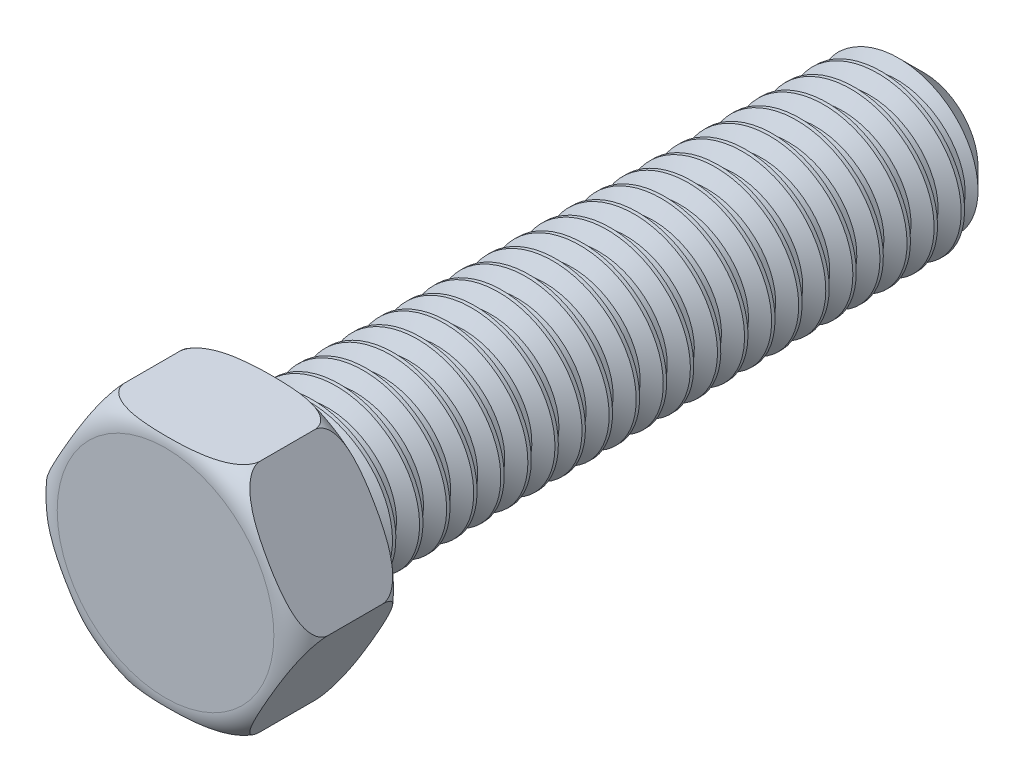
from build123d import *

# Parameters (mm, degrees)
SKETCH2_R           = 2.5
BOSS_EXTRUDE1_DEPTH = 2
FILLET1_R           = 0.5
SKETCH3_OUTSIDE_W   = 8.47
SKETCH3_OUTSIDE_H   = 8.47
CUT_EXTRUDE1_DEPTH  = 5.062019202
SKETCH4_R           = 1.5
BOSS_EXTRUDE2_DEPTH = 12
CHAMFER1_SIZE       = 0.5
THREAD1_PITCH       = 0.5


with BuildPart() as part:
    # Sketch2 → Boss-Extrude1 (new body)
    with BuildSketch(Plane.XY):
        Circle(SKETCH2_R)
    extrude(amount=BOSS_EXTRUDE1_DEPTH)

    # Fillet1
    fillet1_edges = [part.edges().sort_by_distance(p)[0] for p in [
        (-2.5, 0, 0),
        (-2.5, 0, 2),
    ]]
    fillet(fillet1_edges, radius=FILLET1_R)

    # Sketch3 outside → Cut-Extrude1 (cut, through all)
    with BuildSketch(Plane.XY.offset(2)):
        Rectangle(SKETCH3_OUTSIDE_W, SKETCH3_OUTSIDE_H)
        Polygon((2.5, 0), (1.25, 2.165063509), (-1.25, 2.165063509), (-2.5, 0), (-1.25, -2.165063509), (1.25, -2.165063509), align=None, mode=Mode.SUBTRACT)
    extrude(amount=-CUT_EXTRUDE1_DEPTH, mode=Mode.SUBTRACT)


with BuildPart() as body_2:
    # Sketch4 → Boss-Extrude2 (new body)
    with BuildSketch(Plane(origin=(0, 0, 0), x_dir=(-1, 0, 0), z_dir=(0, 0, -1))):
        Circle(SKETCH4_R)
    extrude(amount=BOSS_EXTRUDE2_DEPTH)

    # Chamfer1
    chamfer1_edges = [body_2.edges().sort_by_distance(p)[0] for p in [
        (1.5, 0, -12),
    ]]
    chamfer(chamfer1_edges, length=CHAMFER1_SIZE)

    # Thread1: the profile of Thread Profile1 profile screwed along a right-hand helix of 24 turns, 6 arcs to a turn; built about Z, then put on its axis
    thread1_z = Axis((0, 0, 0), (0, 0, 1))
    thread1_corners = [(1.5003, 0, -0.000173205), (1.5003, 0, 0.437673204), (1.229367062, 0, 0.281249999), (1.229367062, 0, 0.156249999)]
    with BuildLine(mode=Mode.PRIVATE) as thread1_profile:
        Line(thread1_corners[0], thread1_corners[1])
        Line(thread1_corners[1], thread1_corners[2])
        Line(thread1_corners[2], thread1_corners[3])
        Line(thread1_corners[3], thread1_corners[0])
    thread1_cap = Face(thread1_profile.wire())
    thread1_turn_angles = [0, 30, 60, 90, 120, 150, 180, 210, 240, 270, 300, 330, 360]
    thread1_turn_weights = [1, 0.8660254037844387, 1, 0.8660254037844387, 1, 0.8660254037844387, 1, 0.8660254037844387, 1, 0.8660254037844387, 1, 0.8660254037844387, 1]
    thread1_turn_rails = [Edge.make_bspline([Vector(p[0], p[1], 0).rotate(thread1_z, thread1_turn_angles[k]) / thread1_turn_weights[k] + Vector(0, 0, p[2] + THREAD1_PITCH * thread1_turn_angles[k] / 360) for k in range(13)], [0, 0, 0, 1, 1, 2, 2, 3, 3, 4, 4, 5, 5, 6, 6, 6], 2, thread1_turn_weights) for p in thread1_corners]
    thread1_turn_sides = [Face.make_surface_from_curves(thread1_turn_rails[p[0]], thread1_turn_rails[p[1]]) for p in [(0, 1), (1, 2), (2, 3), (3, 0)]]
    thread1 = Plane(origin=(0, 0, 0), x_dir=(-1, 0, 0), z_dir=(0, 0, -1)) * Solid(Shell([*[p.moved(Location((0, 0, THREAD1_PITCH * i))) for i in range(24) for p in thread1_turn_sides], thread1_cap, thread1_cap.rotate(thread1_z, 8640).moved(Location((0, 0, THREAD1_PITCH * 8640 / 360)))]))
    add(thread1, mode=Mode.SUBTRACT)


solid = Compound([part.part, body_2.part])
